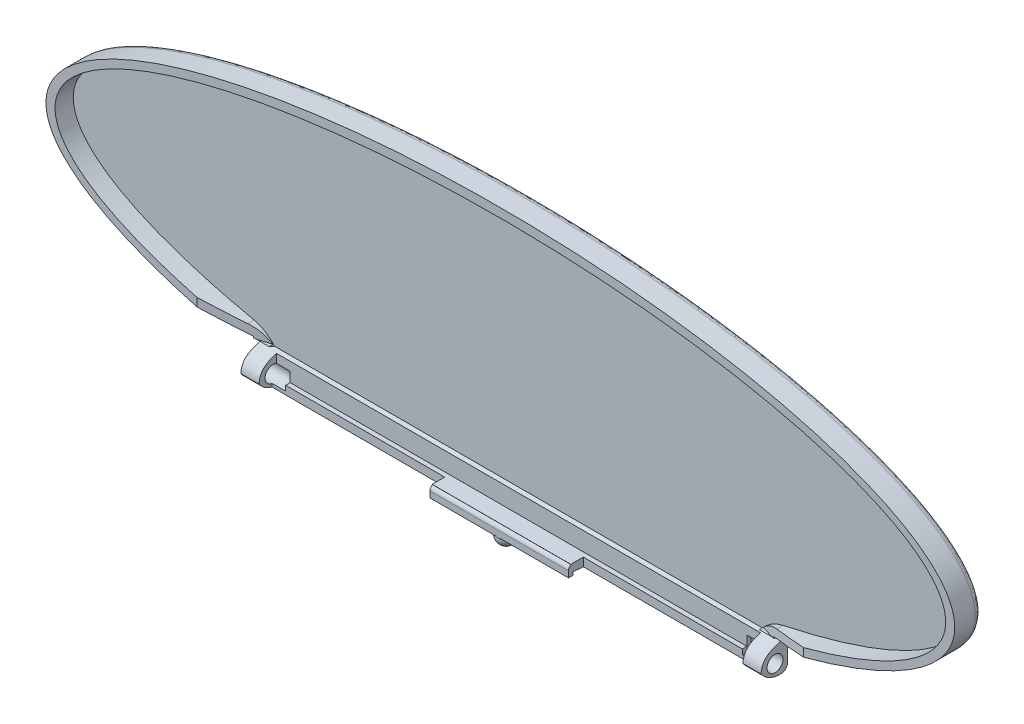
from build123d import *

# Parameters (mm, degrees)
SKETCH2_RX               = 100
SKETCH2_RY               = 30
BOSS_EXTRUDE1_DEPTH      = 6
SKETCH3_RX               = 98
SKETCH3_RY               = 28
CUT_EXTRUDE1_DEPTH       = 4
BOSS_EXTRUDE2_DEPTH      = 9
SKETCH11_W               = 106.5
SKETCH11_H               = 10.000296684
CUT_EXTRUDE2_DEPTH       = 7
SKETCH12_R               = 1.75
CUT_EXTRUDE3_DEPTH       = 7
FILLET3_R                = 1.5
FILLET4_R                = 1.5
SKETCH15_W               = 38
SKETCH15_H               = 6.000342626
CUT_EXTRUDE6_DEPTH       = 10
SKETCH16_W               = 30.5
SKETCH16_H               = 3
CUT_EXTRUDE7_DEPTH       = 10
CUT_EXTRUDE9_DEPTH       = 10
FILLET5_START            = -57.25
FILLET5_DEPTH            = 114.5
CUT_EXTRUDE12_DEPTH      = 161.715358773
CUT_EXTRUDE12_DEPTH_BACK = 128
CUT_EXTRUDE14_DEPTH      = 4
BOSS_EXTRUDE4_DEPTH      = 30.5
SKETCH26_R               = 2
BOSS_EXTRUDE5_DEPTH      = 3
FILLET8_R                = 2
CUT_EXTRUDE17_DEPTH      = 25


with BuildPart() as part:
    # Sketch2 → Boss-Extrude1 (new body)
    with BuildSketch(Plane.XY):
        with Locations(Location((0, 0), (0, 0, 180))):
            Ellipse(SKETCH2_RX, SKETCH2_RY)
    extrude(amount=BOSS_EXTRUDE1_DEPTH)

    # Sketch3 → Cut-Extrude1 (cut)
    with BuildSketch(Plane.XY.offset(6)):
        with Locations(Location((0, 0), (0, 0, 180))):
            Ellipse(SKETCH3_RX, SKETCH3_RY)
    extrude(amount=-CUT_EXTRUDE1_DEPTH, mode=Mode.SUBTRACT)

    # Sketch10 → Boss-Extrude2 (add)
    with BuildSketch(Plane(origin=(0, 0, 0), x_dir=(-1, 0, 0), z_dir=(0, 0, -1))):
        with BuildLine():
            Line((-57.25, -24.597141602), (-57.25, -32.5))
            Line((-57.25, -32.5), (57.25, -32.5))
            Line((57.25, -32.5), (57.25, -24.597141602))
            add(Edge.make_bspline(
                [(-57.25, -24.597141602), (0, -36.589617385), (57.25, -24.597141602)],
                knots=[4.102837225, 4.102837225, 4.102837225, 5.321940736, 5.321940736, 5.321940736], degree=2, weights=[1, 0.81990472, 1]))
        make_face()
    extrude(amount=-BOSS_EXTRUDE2_DEPTH)

    # Sketch11 → Cut-Extrude2 (cut)
    with BuildSketch(Plane.XY.offset(9)):
        with Locations((0, -25.499851658)):
            Rectangle(SKETCH11_W, SKETCH11_H)
    extrude(amount=-CUT_EXTRUDE2_DEPTH, mode=Mode.SUBTRACT)

    # Sketch12 → Cut-Extrude3 (cut)
    with BuildSketch(Plane.ZY.offset(57.25)):
        with Locations(Location((2.8, -29.9, 0), (0, 0, 270))):
            Circle(SKETCH12_R)
    cut_extrude3 = extrude(amount=-CUT_EXTRUDE3_DEPTH, mode=Mode.SUBTRACT)

    # Mirror1: Cut-Extrude3 across plane
    add(cut_extrude3.mirror(Plane(origin=(0, 0, 0), x_dir=(0, 0, 1), z_dir=(1, 0, 0))), mode=Mode.SUBTRACT)

    # Fillet3
    fillet3_edges = [part.edges().sort_by_distance(p)[0] for p in [
        (25.949075421, 28.97236776, 0),
    ]]
    fillet(fillet3_edges, radius=FILLET3_R)

    # Fillet4
    fillet4_edges = [part.edges().sort_by_distance(p)[0] for p in [
        (0, -32.5, 0),
    ]]
    fillet(fillet4_edges, radius=FILLET4_R)

    # Sketch15 → Cut-Extrude6 (cut)
    with BuildSketch(Plane.XZ.offset(32.5)):
        with Locations((-34.25, 5.999828687)):
            Rectangle(SKETCH15_W, SKETCH15_H)
    cut_extrude6 = extrude(amount=-CUT_EXTRUDE6_DEPTH, mode=Mode.SUBTRACT)

    # Mirror2: Cut-Extrude6 across plane
    add(cut_extrude6.mirror(Plane(origin=(0, 0, 0), x_dir=(0, 0, 1), z_dir=(1, 0, 0))), mode=Mode.SUBTRACT)

    # Sketch16 → Cut-Extrude7 (cut)
    with BuildSketch(Plane.XZ.offset(32.5)):
        with Locations((0, 7.5)):
            Rectangle(SKETCH16_W, SKETCH16_H)
    extrude(amount=-CUT_EXTRUDE7_DEPTH, mode=Mode.SUBTRACT)

    # Sketch17 → Cut-Extrude9 (cut)
    with BuildSketch(Plane(origin=(57.25, 0, 0), x_dir=(0, 0, -1), z_dir=(1, 0, 0))):
        Polygon((-6, -24.597141602), (-9, -32.5), (-9, -24.597141602), align=None)
    cut_extrude9 = extrude(amount=-CUT_EXTRUDE9_DEPTH, mode=Mode.SUBTRACT)

    # Mirror3: Cut-Extrude9 across plane
    add(cut_extrude9.mirror(Plane(origin=(0, 0, 0), x_dir=(0, 0, 1), z_dir=(1, 0, 0))), mode=Mode.SUBTRACT)

    # Fillet5: read off the stored shape, not the designer's step
    # Fillet5 outline → Fillet5 (cut)
    with BuildSketch(Plane.YZ.offset(FILLET5_START)):
        with BuildLine():
            ThreePointArc((-32.5, 1.75381421), (-30.339677111, 5.869179796), (-25.725506438, 6.428337993))
            Line((-25.725506438, 6.428337993), (-32.5, 9))
            Line((-32.5, 9), (-32.5, 1.75381421))
        make_face()
    extrude(amount=FILLET5_DEPTH, mode=Mode.SUBTRACT)

    # Sketch21 → Cut-Extrude12 (cut, two sides: drawn at the far end of the back side and taken through both)
    with BuildSketch(Plane(origin=(57.25, 0, 0), x_dir=(0, 0, -1), z_dir=(1, 0, 0)).offset(-CUT_EXTRUDE12_DEPTH_BACK)):
        with BuildLine():
            Line((-7.213293566, -23.369821428), (-7.508502495, -25.903208223))
            Line((-7.508502495, -25.903208223), (-7.213293566, -28.986786655))
            Line((-7.213293566, -28.986786655), (-5.869179796, -30.339677111))
            add(Edge.make_bspline(
                [(-5.869179796, -30.339677111), (-5.758067517, -28.79966419), (-4.723658148, -26.981100258), (0.243773586, -25.976534803), (-4.673717895, -24.291388885), (-6.34577134, -25.096719501), (-7.213293566, -23.369821428)],
                knots=[0, 0, 0, 0, 0.316371867, 0.502278083, 0.701707795, 1, 1, 1, 1], degree=3))
        make_face()
    extrude(amount=CUT_EXTRUDE12_DEPTH + CUT_EXTRUDE12_DEPTH_BACK, mode=Mode.SUBTRACT)

    # Sketch23 → Cut-Extrude14 (cut)
    with BuildSketch(Plane.XY.offset(6)):
        with BuildLine():
            Line((58.506066201, -22.46274052), (52.537434718, -23.596841707))
            Line((52.537434718, -23.596841707), (52.537434718, -27.102143995))
            ThreePointArc((52.537434718, -27.102143995), (54.962712749, -24.063235554), (58.506066201, -22.46274052))
        make_face()
    cut_extrude14 = extrude(amount=-CUT_EXTRUDE14_DEPTH, mode=Mode.SUBTRACT)

    # Mirror4: Cut-Extrude14 across plane
    add(cut_extrude14.mirror(Plane(origin=(0, 0, 0), x_dir=(0, 0, 1), z_dir=(1, 0, 0))), mode=Mode.SUBTRACT)

    # Sketch24 → Boss-Extrude4 (add)
    with BuildSketch(Plane(origin=(15.25, 0, 0), x_dir=(0, 0, -1), z_dir=(1, 0, 0))):
        with BuildLine():
            Line((-2.999657374, -30.5), (-5.253046695, -30.5))
            ThreePointArc((-5.253046695, -30.5), (-5.960153476, -30.792893219), (-6.253046695, -31.5))
            Line((-6.253046695, -31.5), (-6.253046695, -32.845129924))
            Line((-6.253046695, -32.845129924), (-5.307549138, -32.845129924))
            Line((-5.307549138, -32.845129924), (-5.307549138, -32.175740463))
            Line((-5.307549138, -32.175740463), (-2.999657374, -32.34230057))
            Line((-2.999657374, -32.34230057), (-2.999657374, -30.5))
        make_face()
    extrude(amount=-BOSS_EXTRUDE4_DEPTH)

    # Sketch26 → Boss-Extrude5 (add)
    with BuildSketch(Plane(origin=(0, -32.390082132, 2.337586038), x_dir=(1, 0, 0), z_dir=(0, -0.9974058884908626, 0.07198259236616172))):
        with Locations(Location((-0.478828093, 1.815244204, 0), (0, 0, 35.536514687))):
            Circle(SKETCH26_R)
    extrude(amount=BOSS_EXTRUDE5_DEPTH)

    # Fillet8
    fillet8_edges = [part.edges().sort_by_distance(p)[0] for p in [
        (-2.106318634, -35.3353095, 3.204641231),
    ]]
    fillet(fillet8_edges, radius=FILLET8_R)

    # Sketch27 → Cut-Extrude17 (cut)
    with BuildSketch(Plane(origin=(0, 0, 0), x_dir=(1, 0, 0), z_dir=(0, 1, 0))):
        Polygon((66.737815838, -6), (53.696612399, -2), (53.696612399, -8.864067748), align=None)
    cut_extrude17 = extrude(amount=-CUT_EXTRUDE17_DEPTH, mode=Mode.SUBTRACT)

    # Mirror5: Cut-Extrude17 across plane
    add(cut_extrude17.mirror(Plane(origin=(0, 0, 0), x_dir=(0, 0, 1), z_dir=(1, 0, 0))), mode=Mode.SUBTRACT)


solid = part.part
